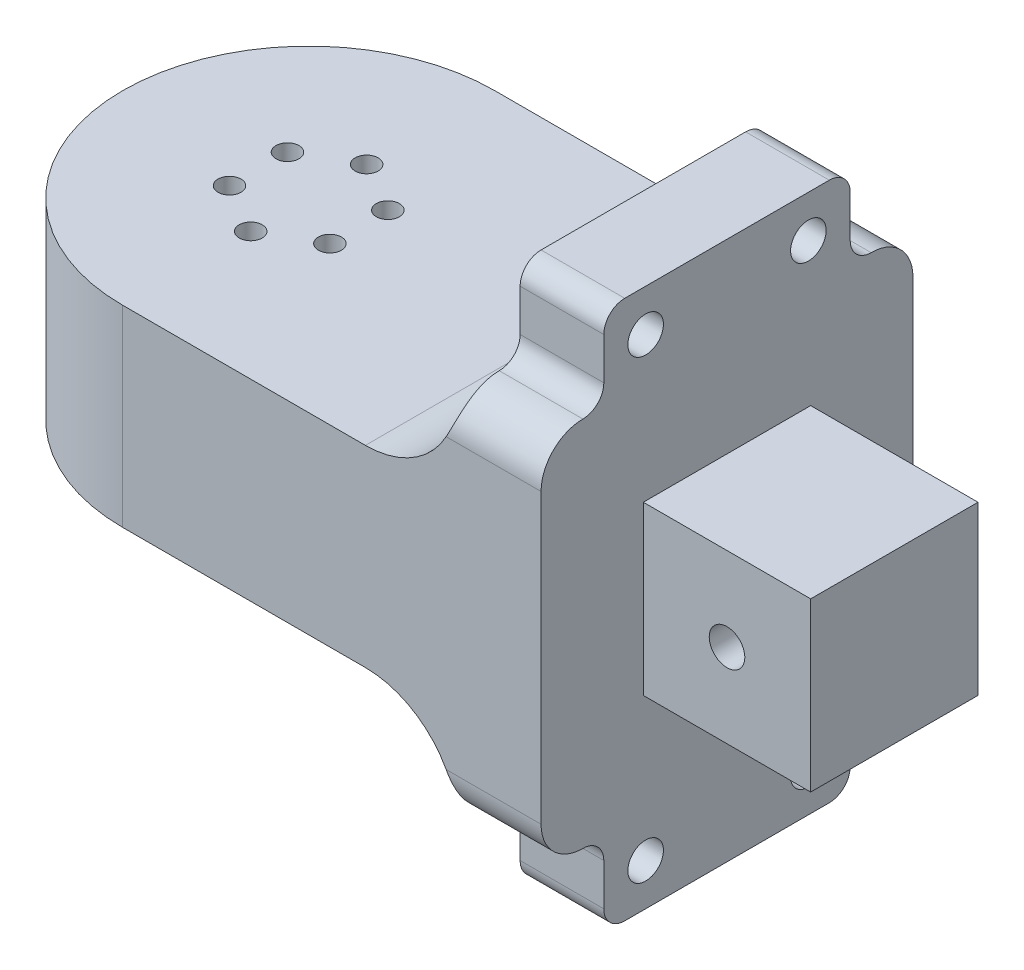
from build123d import *

# Parameters (mm, degrees)
BOSS_EXTRUDE1_DEPTH = 46
CUT_EXTRUDE2_DEPTH  = 76
SKETCH3_W           = 88.9
SKETCH3_H           = 88.9
BOSS_EXTRUDE2_DEPTH = 20
FILLET1_R           = 22
BOSS_EXTRUDE3_DEPTH = 40
SKETCH7_W           = 20
SKETCH7_H           = 20
BOSS_EXTRUDE4_DEPTH = 20
SKETCH8_W           = 20
SKETCH8_H           = 20
BOSS_EXTRUDE5_DEPTH = 20
FILLET3_R           = 10
SKETCH10_R          = 4.25
CUT_EXTRUDE4_DEPTH  = 20
SKETCH11_R          = 4.25
CUT_EXTRUDE5_DEPTH  = 102
SKETCH12_W          = 18.9
SKETCH12_H          = 20
BOSS_EXTRUDE6_DEPTH = 20
FILLET4_START       = 79
FILLET4_DEPTH       = 22
FILLET4_START_2     = 80
FILLET4_2_DEPTH     = 20


with BuildPart() as part:
    # Sketch1 → Boss-Extrude1 (new body)
    with BuildSketch(Plane(origin=(0, 0, 0), x_dir=(1, 0, 0), z_dir=(0, 1, 0))):
        with BuildLine():
            Line((0, 44.45), (80, 44.45))
            Line((80, 44.45), (80, -44.45))
            Line((80, -44.45), (0, -44.45))
            ThreePointArc((0, -44.45), (-44.45, 0), (0, 44.45))
        make_face()
    extrude(amount=BOSS_EXTRUDE1_DEPTH)

    # Sketch2 → Cut-Extrude2 (cut)
    with BuildSketch(Plane(origin=(0, 0, 0), x_dir=(-1, 0, 0), z_dir=(0, -1, 0))):
        with BuildLine():
            Line((-2.38156986, -12.481406461), (0, -13.856406461))
            Line((0, -13.856406461), (2.38156986, -12.481406461))
            ThreePointArc((2.38156986, -12.481406461), (0, -11.106406461), (-2.38156986, -12.481406461))
        make_face()
        with BuildLine():
            Line((2.38156986, -12.481406461), (0, -13.856406461))
            Line((0, -13.856406461), (-2.38156986, -12.481406461))
            ThreePointArc((-2.38156986, -12.481406461), (-0.711752374, -16.512702483), (2.75, -13.856406461))
            ThreePointArc((2.75, -13.856406461), (2.656296022, -13.144654087), (2.38156986, -12.481406461))
        make_face()
        with BuildLine():
            ThreePointArc((-12, -4.17820323), (-14.38156986, -8.30320323), (-9.61843014, -8.30320323))
            Line((-9.61843014, -8.30320323), (-12, -6.92820323))
            Line((-12, -6.92820323), (-12, -4.17820323))
        make_face()
        with BuildLine():
            Line((-12, -6.92820323), (-9.61843014, -8.30320323))
            ThreePointArc((-9.61843014, -8.30320323), (-9.343703978, -7.639955604), (-9.25, -6.92820323))
            ThreePointArc((-9.25, -6.92820323), (-10.055456352, -4.983659582), (-12, -4.17820323))
            Line((-12, -4.17820323), (-12, -6.92820323))
        make_face()
        with BuildLine():
            ThreePointArc((-9.61843014, 8.30320323), (-14.38156986, 8.30320323), (-12, 4.17820323))
            Line((-12, 4.17820323), (-12, 6.92820323))
            Line((-12, 6.92820323), (-9.61843014, 8.30320323))
        make_face()
        with BuildLine():
            Line((-12, 6.92820323), (-12, 4.17820323))
            ThreePointArc((-12, 4.17820323), (-10.055456352, 4.983659582), (-9.25, 6.92820323))
            ThreePointArc((-9.25, 6.92820323), (-9.343703978, 7.639955604), (-9.61843014, 8.30320323))
            Line((-9.61843014, 8.30320323), (-12, 6.92820323))
        make_face()
        with BuildLine():
            ThreePointArc((-2.38156986, 12.481406461), (0, 11.106406461), (2.38156986, 12.481406461))
            Line((2.38156986, 12.481406461), (0, 13.856406461))
            Line((0, 13.856406461), (-2.38156986, 12.481406461))
        make_face()
        with BuildLine():
            Line((0, 13.856406461), (2.38156986, 12.481406461))
            ThreePointArc((2.38156986, 12.481406461), (2.656296022, 13.144654087), (2.75, 13.856406461))
            ThreePointArc((2.75, 13.856406461), (-0.711752374, 16.512702483), (-2.38156986, 12.481406461))
            Line((-2.38156986, 12.481406461), (0, 13.856406461))
        make_face()
        with BuildLine():
            ThreePointArc((9.61843014, 8.30320323), (9.61843014, 5.55320323), (12, 4.17820323))
            Line((12, 4.17820323), (12, 6.92820323))
            Line((12, 6.92820323), (9.61843014, 8.30320323))
        make_face()
        with BuildLine():
            Line((12, 6.92820323), (12, 4.17820323))
            ThreePointArc((12, 4.17820323), (13.944543648, 4.983659582), (14.75, 6.92820323))
            ThreePointArc((14.75, 6.92820323), (12.711752374, 9.584499253), (9.61843014, 8.30320323))
            Line((9.61843014, 8.30320323), (12, 6.92820323))
        make_face()
        with BuildLine():
            ThreePointArc((12, -4.17820323), (9.61843014, -5.55320323), (9.61843014, -8.30320323))
            Line((9.61843014, -8.30320323), (12, -6.92820323))
            Line((12, -6.92820323), (12, -4.17820323))
        make_face()
        with BuildLine():
            Line((12, -6.92820323), (9.61843014, -8.30320323))
            ThreePointArc((9.61843014, -8.30320323), (12.711752374, -9.584499253), (14.75, -6.92820323))
            ThreePointArc((14.75, -6.92820323), (13.944543648, -4.983659582), (12, -4.17820323))
            Line((12, -4.17820323), (12, -6.92820323))
        make_face()
    extrude(amount=-CUT_EXTRUDE2_DEPTH, mode=Mode.SUBTRACT)

    # Sketch3 → Boss-Extrude2 (add)
    with BuildSketch(Plane(origin=(80, 0, 0), x_dir=(0, 0, -1), z_dir=(1, 0, 0))):
        with Locations((0, 23)):
            Rectangle(SKETCH3_W, SKETCH3_H)
    extrude(amount=BOSS_EXTRUDE2_DEPTH)

    # Fillet1
    # the kernel refuses this fillet: 22 mm, written as the material it adds along each edge
    with BuildSketch(Plane(origin=(80, 46, -44.45), x_dir=(0, 1, 0), z_dir=(0, 0, 1))) as fillet1_piece_1:
        with BuildLine():
            CenterArc((22, 21.993123925), FILLET1_R, 180, 88.567456262)
            Line((0, 21.993123925), (-0.44, 21.993123925))
            Line((-0.44, 21.993123925), (-0.44, 0))
            Line((-0.44, 0), (0, -0.44))
            ThreePointArc((0, -0.44), (10.725, -0.44), (21.439, -0.439862479))
            Line((21.439, -0.439862479), (21.45, 0))
        make_face()
    extrude(amount=88.9)
    with BuildSketch(Plane(origin=(80, 0, -44.45), x_dir=(0, -1, 0), z_dir=(0, 0, 1))) as fillet1_piece_2:
        with BuildLine():
            CenterArc((22, -21.993123925), FILLET1_R, 91.432543738, 88.567456262)
            Line((0, -21.993123925), (-0.44, -21.993123925))
            Line((-0.44, -21.993123925), (-0.44, 0))
            Line((-0.44, 0), (0, 0.44))
            ThreePointArc((0, 0.44), (10.725, 0.44), (21.439, 0.439862479))
            Line((21.439, 0.439862479), (21.45, 0))
        make_face()
    extrude(amount=88.9)

    # Sketch5 → Boss-Extrude3 (add)
    with BuildSketch(Plane(origin=(100, 0, 0), x_dir=(0, 0, -1), z_dir=(1, 0, 0))):
        Polygon((20, 43), (0, 43), (-20, 43), (-20, 3), (20, 3), align=None)
    extrude(amount=BOSS_EXTRUDE3_DEPTH)

    # Sketch7 → Boss-Extrude4 (add)
    with BuildSketch(Plane(origin=(0, 67.45, 0), x_dir=(1, 0, 0), z_dir=(0, 1, 0))):
        with Locations((90, 19.45)):
            Rectangle(SKETCH7_W, SKETCH7_H)
        with Locations((90, -19.45)):
            Rectangle(SKETCH7_W, SKETCH7_H)
    extrude(amount=BOSS_EXTRUDE4_DEPTH)

    # Sketch8 → Boss-Extrude5 (add)
    with BuildSketch(Plane.XZ.offset(21.45)):
        with Locations((90, 19.45)):
            Rectangle(SKETCH8_W, SKETCH8_H)
        with Locations((90, -19.45)):
            Rectangle(SKETCH8_W, SKETCH8_H)
    extrude(amount=BOSS_EXTRUDE5_DEPTH)

    # Fillet3
    fillet3_edges = [part.edges().sort_by_distance(p)[0] for p in [
        (90, -21.45, 44.45),
        (90, -21.45, -44.45),
        (90, 67.45, -44.45),
        (90, 67.45, 44.45),
    ]]
    fillet(fillet3_edges, radius=FILLET3_R)

    # Sketch10 → Cut-Extrude4 (cut)
    with BuildSketch(Plane.ZY.offset(-80)):
        with Locations(Location((-19.45, 77.45, 0), (0, 0, 270))):
            Circle(SKETCH10_R)
        with Locations(Location((19.45, 77.45, 0), (0, 0, 270))):
            Circle(SKETCH10_R)
        with Locations(Location((19.45, -31.45, 0), (0, 0, 270))):
            Circle(SKETCH10_R)
        with Locations(Location((-19.45, -31.45, 0), (0, 0, 270))):
            Circle(SKETCH10_R)
    extrude(amount=-CUT_EXTRUDE4_DEPTH, mode=Mode.SUBTRACT)

    # Sketch11 → Cut-Extrude5 (cut)
    with BuildSketch(Plane(origin=(0, 0, -20), x_dir=(-1, 0, 0), z_dir=(0, 0, -1))):
        with Locations((-120, 23)):
            Circle(SKETCH11_R)
    extrude(amount=-CUT_EXTRUDE5_DEPTH, mode=Mode.SUBTRACT)

    # Sketch12 → Boss-Extrude6 (add)
    with BuildSketch(Plane(origin=(100, 0, 0), x_dir=(0, 0, -1), z_dir=(1, 0, 0))):
        with Locations((0, 77.45)):
            Rectangle(SKETCH12_W, SKETCH12_H)
        with Locations((0, -31.45)):
            Rectangle(SKETCH12_W, SKETCH12_H)
    extrude(amount=-BOSS_EXTRUDE6_DEPTH)

    # Fillet4: read off the stored shape, not the designer's step
    # Fillet4 outline → Fillet4 (cut)
    with BuildSketch(Plane.YZ.offset(FILLET4_START)):
        with BuildLine():
            ThreePointArc((82.45, 29.45), (85.985533906, 27.985533906), (87.45, 24.45))
            Line((87.45, 24.45), (87.45, 29.45))
            Line((87.45, 29.45), (82.45, 29.45))
        make_face()
        with BuildLine():
            ThreePointArc((87.45, -24.45), (85.985533906, -27.985533906), (82.45, -29.45))
            Line((82.45, -29.45), (87.45, -29.45))
            Line((87.45, -29.45), (87.45, -24.45))
        make_face()
        with BuildLine():
            Line((-41.45, -29.45), (-36.45, -29.45))
            ThreePointArc((-36.45, -29.45), (-39.985533906, -27.985533906), (-41.45, -24.45))
            Line((-41.45, -24.45), (-41.45, -29.45))
        make_face()
        with BuildLine():
            Line((-41.45, 29.45), (-41.45, 24.45))
            ThreePointArc((-41.45, 24.45), (-39.985533906, 27.985533906), (-36.45, 29.45))
            Line((-36.45, 29.45), (-41.45, 29.45))
        make_face()
    extrude(amount=FILLET4_DEPTH, mode=Mode.SUBTRACT)

    # Fillet4 2 outline → Fillet4 2 (add)
    with BuildSketch(Plane.YZ.offset(FILLET4_START_2)):
        with BuildLine():
            Line((67.45, 29.45), (72.45, 29.45))
            ThreePointArc((72.45, 29.45), (68.914466094, 30.914466094), (67.45, 34.45))
            Line((67.45, 34.45), (67.45, 29.45))
        make_face()
        with BuildLine():
            ThreePointArc((67.45, -34.45), (68.914466094, -30.914466094), (72.45, -29.45))
            Line((72.45, -29.45), (67.45, -29.45))
            Line((67.45, -29.45), (67.45, -34.45))
        make_face()
        with BuildLine():
            Line((-21.45, -29.45), (-26.45, -29.45))
            ThreePointArc((-26.45, -29.45), (-22.914466094, -30.914466094), (-21.45, -34.45))
            Line((-21.45, -34.45), (-21.45, -29.45))
        make_face()
        with BuildLine():
            ThreePointArc((-21.45, 34.45), (-22.914466094, 30.914466094), (-26.45, 29.45))
            Line((-26.45, 29.45), (-21.45, 29.45))
            Line((-21.45, 29.45), (-21.45, 34.45))
        make_face()
    extrude(amount=FILLET4_2_DEPTH)


solid = part.part
